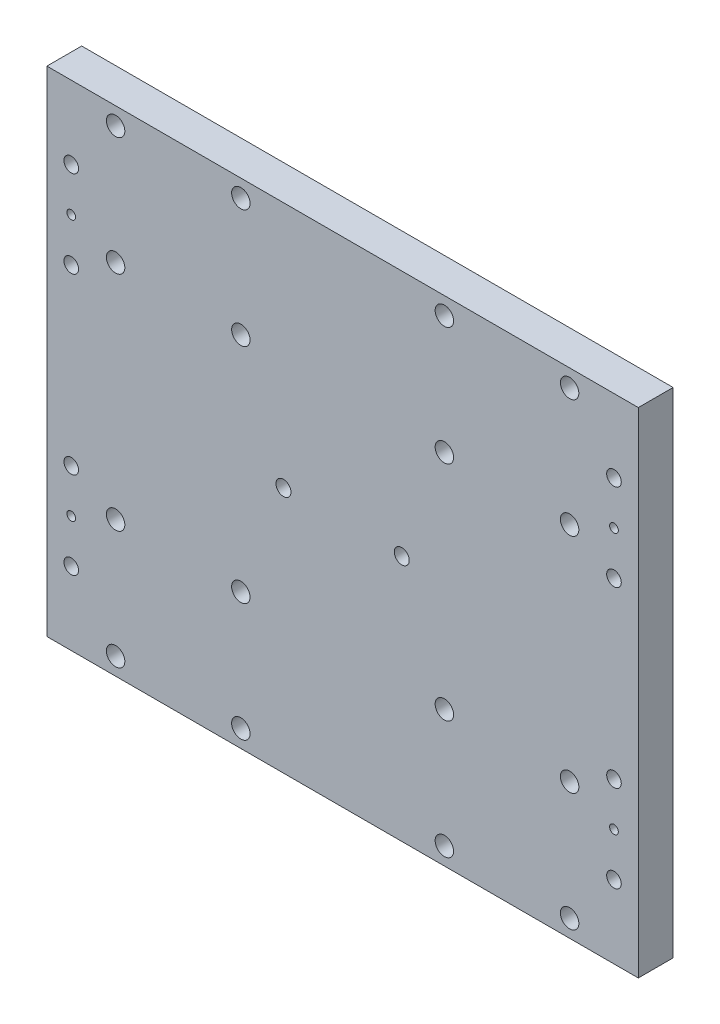
from build123d import *

# Parameters (mm, degrees)
SKETCH1_W                      = 170
SKETCH1_H                      = 142
BOSS_EXTRUDE1_DEPTH            = 5
M5_CLEARANCE_HOLE1_D           = 5.3
MIRROR3_COPY_1_D               = 5.3
MIRROR3_COPY_2_D               = 5.3
M4_CLEARANCE_HOLE1_D           = 4.3
M5X0_8_TAPPED_HOLE1_AT_2_COUNT = 2
M5X0_8_TAPPED_HOLE1_AT_2_PITCH = 25
SKETCH6_R                      = 1.25
CUT_EXTRUDE5_DEPTH             = 112.202517957
MIRROR4_COPY_2_SKETCH_R        = 1.25
MIRROR4_COPY_2_DEPTH           = 112.202517957
MIRROR4_COPY_5_SKETCH_R        = 1.25
MIRROR4_COPY_5_DEPTH           = 112.202517957


with BuildPart() as part:
    # Sketch1 → Boss-Extrude1 (new, symmetric)
    with BuildSketch(Plane.XY):
        Rectangle(SKETCH1_W, SKETCH1_H)
    extrude(amount=BOSS_EXTRUDE1_DEPTH, both=True)

    # M5 Clearance Hole1 (through all)
    with Locations(Plane.XY.offset(5)):
        with Locations((-65.25, 66), (-29.25, 66), (-29.25, 32), (-65.25, 32)):
            m5_clearance_hole1 = Hole(M5_CLEARANCE_HOLE1_D / 2)

    # Mirror2: M5 Clearance Hole1 across plane
    add(m5_clearance_hole1.mirror(Plane.ZX), mode=Mode.SUBTRACT)

    # Mirror3 copy 1 (through all)
    with Locations(Plane(origin=(0, 0, 5), x_dir=(-1, 0, 0), z_dir=(0, 0, 1))):
        with Locations((-65.25, 66), (-29.25, 66), (-29.25, 32), (-65.25, 32)):
            Hole(MIRROR3_COPY_1_D / 2)

    # Mirror3 copy 2 (through all)
    with Locations(Plane(origin=(0, 0, 5), x_dir=(-1, 0, 0), z_dir=(0, 0, 1))):
        with Locations((-65.25, -66), (-29.25, -66), (-29.25, -32), (-65.25, -32)):
            Hole(MIRROR3_COPY_2_D / 2)

    # M4 Clearance Hole1 (through all)
    with Locations(Plane.XY.offset(5)):
        with Locations((-17, 0), (17, 0)):
            Hole(M4_CLEARANCE_HOLE1_D / 2)

    # Sketch11 → M5x0.8 Tapped Hole1 (revolve, cut)
    with BuildSketch(Plane(origin=(-78, 50, 5), x_dir=(0, -1, 0), z_dir=(1, 0, 0))):
        Polygon((0, 0), (0, 15.2618073), (2.1, 14), (2.1, 0), align=None)
    m5x0_8_tapped_hole1 = revolve(axis=Axis((-78, 50, 11.35), (0, 0, -1)), mode=Mode.SUBTRACT)

    # M5x0.8 Tapped Hole1 at 2: M5x0.8 Tapped Hole1 ×2
    with Locations(*[(0, -i * M5X0_8_TAPPED_HOLE1_AT_2_PITCH, 0) for i in range(1, M5X0_8_TAPPED_HOLE1_AT_2_COUNT)]):
        add(m5x0_8_tapped_hole1, mode=Mode.SUBTRACT)

    # Sketch6 → Cut-Extrude5 (cut, through all)
    with BuildSketch(Plane.XY.offset(5)):
        with Locations((-78, 37.5)):
            Circle(SKETCH6_R)
    cut_extrude5 = extrude(amount=-CUT_EXTRUDE5_DEPTH, mode=Mode.SUBTRACT)

    # Mirror1: M5x0.8 Tapped Hole1, Cut-Extrude5 across plane
    add(m5x0_8_tapped_hole1.mirror(Plane(origin=(0, 0, 0), x_dir=(0, 0, 1), z_dir=(1, 0, 0))), mode=Mode.SUBTRACT)
    add(cut_extrude5.mirror(Plane(origin=(0, 0, 0), x_dir=(0, 0, 1), z_dir=(1, 0, 0))), mode=Mode.SUBTRACT)

    # Mirror1 copy 1 sketch → Mirror1 copy 1 (revolve, cut)
    with BuildSketch(Plane(origin=(78, 25, 5), x_dir=(0, -1, 0), z_dir=(-1, 0, 0))):
        Polygon((0, 0), (0, -15.2618073), (2.1, -14), (2.1, 0), align=None)
    revolve(axis=Axis((78, 25, 11.35), (0, 0, 1)), mode=Mode.SUBTRACT)

    # Mirror4 copy 1 sketch → Mirror4 copy 1 (revolve, cut)
    with BuildSketch(Plane(origin=(78, -50, 5), x_dir=(0, 1, 0), z_dir=(-1, 0, 0))):
        Polygon((0, 0), (0, 15.2618073), (2.1, 14), (2.1, 0), align=None)
    revolve(axis=Axis((78, -50, 11.35), (0, 0, -1)), mode=Mode.SUBTRACT)

    # Mirror4 copy 2 sketch → Mirror4 copy 2 (cut, through all)
    with BuildSketch(Plane(origin=(0, 0, 5), x_dir=(-1, 0, 0), z_dir=(0, 0, 1))):
        with Locations((-78, 37.5)):
            Circle(MIRROR4_COPY_2_SKETCH_R)
    extrude(amount=-MIRROR4_COPY_2_DEPTH, mode=Mode.SUBTRACT)

    # Mirror4 copy 3 sketch → Mirror4 copy 3 (revolve, cut)
    with BuildSketch(Plane(origin=(78, -25, 5), x_dir=(0, 1, 0), z_dir=(-1, 0, 0))):
        Polygon((0, 0), (0, 15.2618073), (2.1, 14), (2.1, 0), align=None)
    revolve(axis=Axis((78, -25, 11.35), (0, 0, -1)), mode=Mode.SUBTRACT)

    # Mirror4 copy 4 sketch → Mirror4 copy 4 (revolve, cut)
    with BuildSketch(Plane(origin=(-78, -50, 5), x_dir=(0, 1, 0), z_dir=(1, 0, 0))):
        Polygon((0, 0), (0, -15.2618073), (2.1, -14), (2.1, 0), align=None)
    revolve(axis=Axis((-78, -50, 11.35), (0, 0, 1)), mode=Mode.SUBTRACT)

    # Mirror4 copy 5 sketch → Mirror4 copy 5 (cut, through all)
    with BuildSketch(Plane.XY.offset(5)):
        with Locations((-78, -37.5)):
            Circle(MIRROR4_COPY_5_SKETCH_R)
    extrude(amount=-MIRROR4_COPY_5_DEPTH, mode=Mode.SUBTRACT)

    # Mirror4 copy 6 sketch → Mirror4 copy 6 (revolve, cut)
    with BuildSketch(Plane(origin=(-78, -25, 5), x_dir=(0, 1, 0), z_dir=(1, 0, 0))):
        Polygon((0, 0), (0, -15.2618073), (2.1, -14), (2.1, 0), align=None)
    revolve(axis=Axis((-78, -25, 11.35), (0, 0, 1)), mode=Mode.SUBTRACT)


solid = part.part
